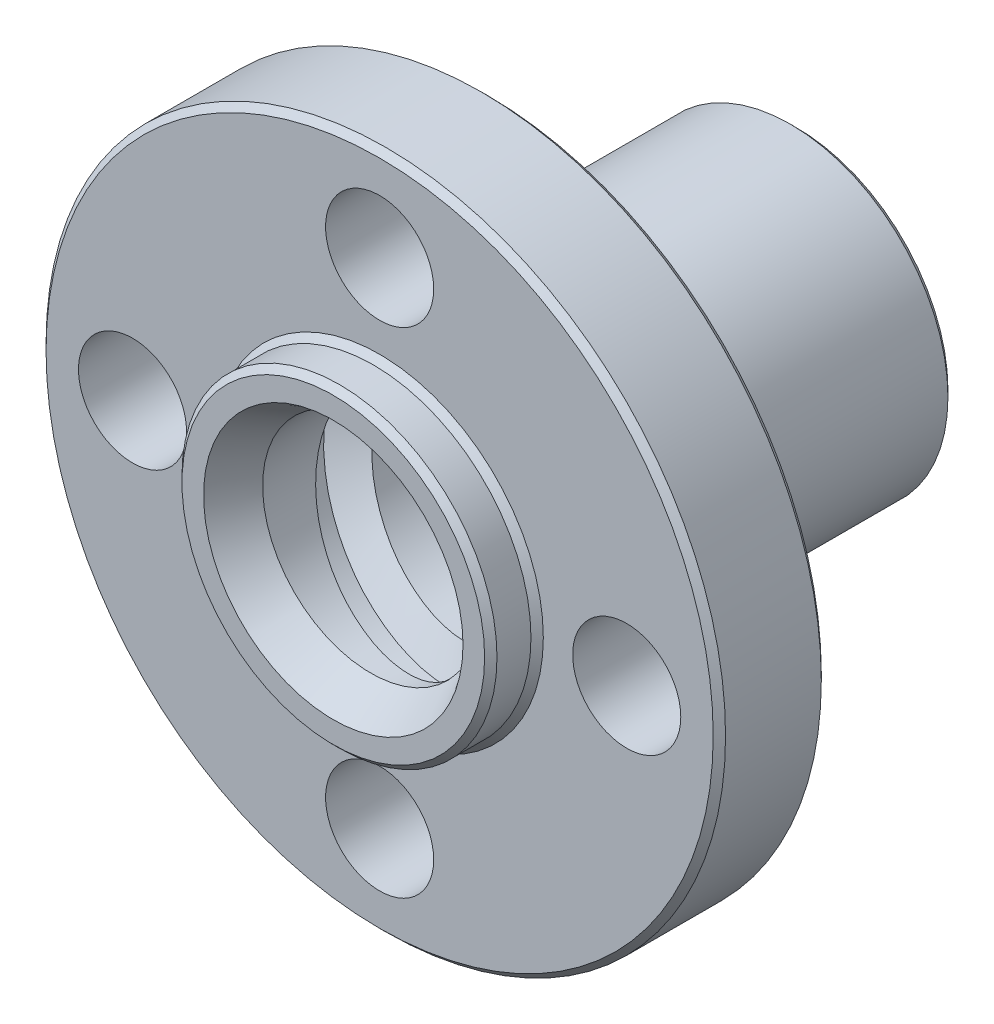
from build123d import *
from OCP.BRepFilletAPI import BRepFilletAPI_MakeChamfer

# Parameters (mm, degrees)
ESQUISSE1_R                           = 11
ESQUISSE1_R_2                         = 5.1
ESQUISSE1_R_3                         = 1.75
BOSS_EXTRU_1_DEPTH                    = 3.5
BOSS_EXTRU_2_DEPTH                    = 1.5
BOSS_EXTRU_2_DEPTH_BACK               = 13.5
ESQUISSE2_R                           = 5.1
ESQUISSE2_R_2                         = 3.5
CHANFREIN2_SIZE                       = 0.7
CHANFREIN2_SIZE2                      = 1.212435565
ENL_VEMENT_DE_MATI_RE_BALAYAGE1_PITCH = 4.5
CHANFREIN3_SIZE                       = 0.2


with BuildPart() as part:
    # Esquisse1 → Boss.-Extru.1 (new body)
    with BuildSketch(Plane.XY):
        Circle(ESQUISSE1_R)
        Circle(ESQUISSE1_R_2, mode=Mode.SUBTRACT)
        with Locations((0, 8)):
            Circle(ESQUISSE1_R_3, mode=Mode.SUBTRACT)
        with Locations((8, 0)):
            Circle(ESQUISSE1_R_3, mode=Mode.SUBTRACT)
        with Locations((0, -8)):
            Circle(ESQUISSE1_R_3, mode=Mode.SUBTRACT)
        with Locations((-8, 0)):
            Circle(ESQUISSE1_R_3, mode=Mode.SUBTRACT)
    extrude(amount=BOSS_EXTRU_1_DEPTH)

    # Esquisse2 → Boss.-Extru.2 (add, two sides: drawn at the far end of the back side and taken through both)
    with BuildSketch(Plane.XY.offset(3.5).offset(-BOSS_EXTRU_2_DEPTH_BACK)):
        Circle(ESQUISSE2_R)
        Circle(ESQUISSE2_R_2, mode=Mode.SUBTRACT)
    extrude(amount=BOSS_EXTRU_2_DEPTH + BOSS_EXTRU_2_DEPTH_BACK)

    # Chanfrein2: one chamfer whose edges measure the first distance from different faces: ONE call of the kernel's chamfer builder (chamfer() names one face for all edges)
    chanfrein2_edges_1 = [part.edges().sort_by_distance(p)[0] for p in [
        (-3.5, 0, -10),
    ]]
    chanfrein2_side_1 = [part.faces().sort_by_distance(p)[0] for p in [
        (-3.5, 0, -3.25),
    ]]
    chanfrein2_edges_2 = [part.edges().sort_by_distance(p)[0] for p in [
        (-3.5, 0, 5),
    ]]
    chanfrein2_side_2 = [part.faces().sort_by_distance(p)[0] for p in [
        (-4.955750217, 0, 5),
    ]]
    chanfrein2 = BRepFilletAPI_MakeChamfer(part.part.solid().wrapped)
    for e in chanfrein2_edges_1:
        chanfrein2.Add(CHANFREIN2_SIZE, CHANFREIN2_SIZE2, e.wrapped, chanfrein2_side_1[0].wrapped)  # the first distance lies on this face
    for e in chanfrein2_edges_2:
        chanfrein2.Add(CHANFREIN2_SIZE, CHANFREIN2_SIZE2, e.wrapped, chanfrein2_side_2[0].wrapped)  # the first distance lies on this face
    add(Compound.cast(chanfrein2.Shape()), mode=Mode.REPLACE)

    # Enlèvement de matière-Balayage1: arcs per turn and ends read off the stored shape
    # Enlèvement de matière-Balayage1: the profile of Esquisse6 screwed along a right-hand helix through 5.555556 turns, 12 arcs to a turn; built about Z, then put on its axis
    enl_vement_de_mati_re_balayage1_z = Axis((0, 0, 0), (0, 0, 1))
    enl_vement_de_mati_re_balayage1_corners = [(4.5, 1.2566e-05, 0.492005646), (4.5, 1.2566e-05, -0.171321177), (2.257915532, 6.305e-06, -1.465789248), (2.257915532, 6.305e-06, 1.786473717)]
    with BuildLine(mode=Mode.PRIVATE) as enl_vement_de_mati_re_balayage1_profile:
        Line(enl_vement_de_mati_re_balayage1_corners[0], enl_vement_de_mati_re_balayage1_corners[1])
        Line(enl_vement_de_mati_re_balayage1_corners[1], enl_vement_de_mati_re_balayage1_corners[2])
        Line(enl_vement_de_mati_re_balayage1_corners[2], enl_vement_de_mati_re_balayage1_corners[3])
        Line(enl_vement_de_mati_re_balayage1_corners[3], enl_vement_de_mati_re_balayage1_corners[0])
    enl_vement_de_mati_re_balayage1_cap = Face(enl_vement_de_mati_re_balayage1_profile.wire())
    enl_vement_de_mati_re_balayage1_turn_angles = [0, 15, 30, 45, 60, 75, 90, 105, 120, 135, 150, 165, 180, 195, 210, 225, 240, 255, 270, 285, 300, 315, 330, 345, 360]
    enl_vement_de_mati_re_balayage1_turn_weights = [1, 0.9659258262890683, 1, 0.9659258262890683, 1, 0.9659258262890683, 1, 0.9659258262890683, 1, 0.9659258262890683, 1, 0.9659258262890683, 1, 0.9659258262890683, 1, 0.9659258262890683, 1, 0.9659258262890683, 1, 0.9659258262890683, 1, 0.9659258262890683, 1, 0.9659258262890683, 1]
    enl_vement_de_mati_re_balayage1_turn_rails = [Edge.make_bspline([Vector(p[0], p[1], 0).rotate(enl_vement_de_mati_re_balayage1_z, enl_vement_de_mati_re_balayage1_turn_angles[k]) / enl_vement_de_mati_re_balayage1_turn_weights[k] + Vector(0, 0, p[2] + ENL_VEMENT_DE_MATI_RE_BALAYAGE1_PITCH * enl_vement_de_mati_re_balayage1_turn_angles[k] / 360) for k in range(25)], [0, 0, 0, 1, 1, 2, 2, 3, 3, 4, 4, 5, 5, 6, 6, 7, 7, 8, 8, 9, 9, 10, 10, 11, 11, 12, 12, 12], 2, enl_vement_de_mati_re_balayage1_turn_weights) for p in enl_vement_de_mati_re_balayage1_corners]
    enl_vement_de_mati_re_balayage1_turn_sides = [Face.make_surface_from_curves(enl_vement_de_mati_re_balayage1_turn_rails[p[0]], enl_vement_de_mati_re_balayage1_turn_rails[p[1]]) for p in [(0, 1), (1, 2), (2, 3), (3, 0)]]
    enl_vement_de_mati_re_balayage1_last_angles = [1800, 1815, 1830, 1845, 1860, 1875, 1890, 1905, 1920, 1935, 1950, 1965, 1980, 1990, 2000]
    enl_vement_de_mati_re_balayage1_last_weights = [1, 0.9659258262890683, 1, 0.9659258262890683, 1, 0.9659258262890683, 1, 0.9659258262890683, 1, 0.9659258262890683, 1, 0.9659258262890683, 1, 0.984807753012207, 1]
    enl_vement_de_mati_re_balayage1_last_rails = [Edge.make_bspline([Vector(p[0], p[1], 0).rotate(enl_vement_de_mati_re_balayage1_z, enl_vement_de_mati_re_balayage1_last_angles[k]) / enl_vement_de_mati_re_balayage1_last_weights[k] + Vector(0, 0, p[2] + ENL_VEMENT_DE_MATI_RE_BALAYAGE1_PITCH * enl_vement_de_mati_re_balayage1_last_angles[k] / 360) for k in range(15)], [0, 0, 0, 1, 1, 2, 2, 3, 3, 4, 4, 5, 5, 6, 6, 7, 7, 7], 2, enl_vement_de_mati_re_balayage1_last_weights) for p in enl_vement_de_mati_re_balayage1_corners]
    enl_vement_de_mati_re_balayage1_last_sides = [Face.make_surface_from_curves(enl_vement_de_mati_re_balayage1_last_rails[p[0]], enl_vement_de_mati_re_balayage1_last_rails[p[1]]) for p in [(0, 1), (1, 2), (2, 3), (3, 0)]]
    enl_vement_de_mati_re_balayage1 = Plane(origin=(0, 0, 3.5), x_dir=(1, 0, 0), z_dir=(0, 0, -1)) * Solid(Shell([*[p.moved(Location((0, 0, ENL_VEMENT_DE_MATI_RE_BALAYAGE1_PITCH * i))) for i in range(5) for p in enl_vement_de_mati_re_balayage1_turn_sides], *enl_vement_de_mati_re_balayage1_last_sides, enl_vement_de_mati_re_balayage1_cap, enl_vement_de_mati_re_balayage1_cap.rotate(enl_vement_de_mati_re_balayage1_z, 2000).moved(Location((0, 0, ENL_VEMENT_DE_MATI_RE_BALAYAGE1_PITCH * 2000 / 360)))]))
    add(enl_vement_de_mati_re_balayage1, mode=Mode.SUBTRACT)

    # Chanfrein3
    chanfrein3_edges = [part.edges().sort_by_distance(p)[0] for p in [
        (-11, 0, 0),
        (-5.1, 0, 0),
        (-5.1, 0, -10),
        (-5.1, 0, 5),
        (-11, 0, 3.5),
        (-5.1, 0, 3.5),
    ]]
    chamfer(chanfrein3_edges, length=CHANFREIN3_SIZE)


solid = part.part
